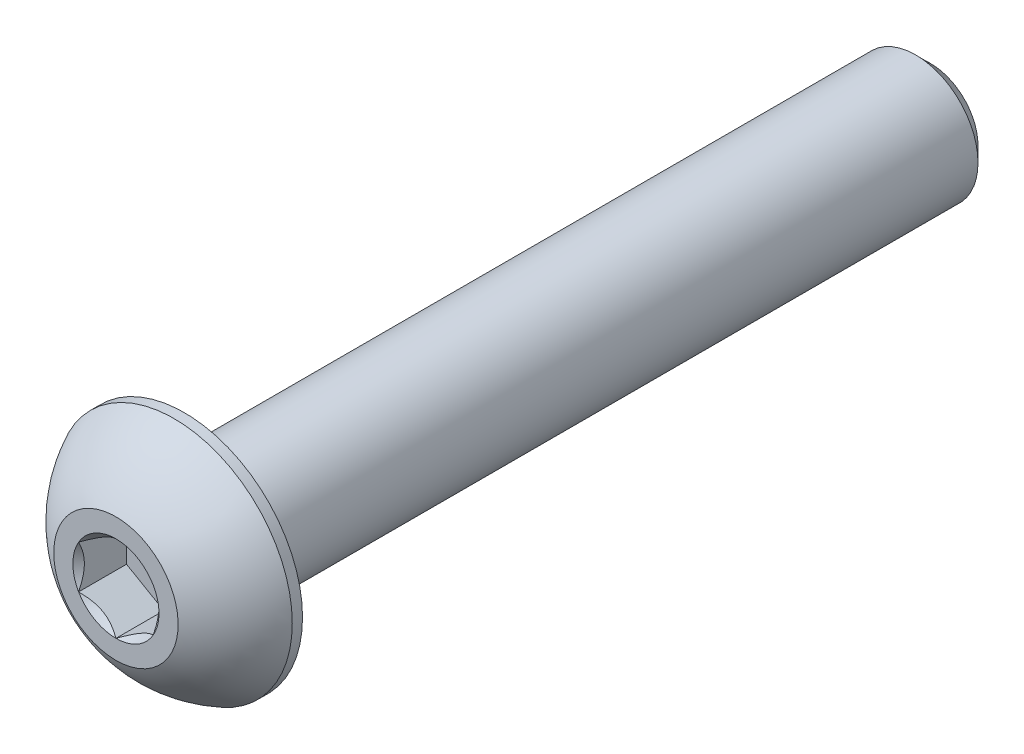
from build123d import *

# Parameters (mm, degrees)
CUT_EXTRUDE2_DEPTH = 1.925


with BuildPart() as part:
    # Sketch10 → Revolve3 (revolve)
    with BuildSketch(Plane(origin=(0, 0, 0), x_dir=(0, 0, -1), z_dir=(1, 0, 0)), mode=Mode.PRIVATE) as revolve3_sk:
        Polygon((32.15, 2.5), (32.75, 1.9), (32.75, 0), (2.75, 0), (2.75, 2.5), align=None)
    revolve(revolve3_sk.sketch.rotate(Axis((0, 0, 0), (0, 0, -1)), 90), axis=Axis((0, 0, 0), (0, 0, -1)))

    # Sketch7 → Revolve2 (revolve)
    with BuildSketch(Plane(origin=(0, 0, 0), x_dir=(0, 0, -1), z_dir=(1, 0, 0)), mode=Mode.PRIVATE) as revolve2_sk:
        with BuildLine():
            Line((2.3375, 4.75), (2.75, 4.75))
            Line((2.75, 4.75), (2.75, 0))
            Line((2.75, 0), (0, 0))
            Line((0, 0), (0, 2.5))
            ThreePointArc((0, 2.5), (0.991875183, 3.808753282), (2.3375, 4.75))
        make_face()
    revolve(revolve2_sk.sketch.rotate(Axis((0, 0, 0), (0, 0, -1)), 180), axis=Axis((0, 0, 0), (0, 0, -1)))

    # Sketch5 → Cut-Extrude2 (cut)
    with BuildSketch(Plane.XY):
        Polygon((1.5, -0.866025404), (1.5, 0.866025404), (0, 1.732050808), (-1.5, 0.866025404), (-1.5, -0.866025404), (0, -1.732050808), align=None)
    extrude(amount=-CUT_EXTRUDE2_DEPTH, mode=Mode.SUBTRACT)

    # Cut-Extrude3 cone 1 section (through the dimple's axis) → Cut-Extrude3 (revolve, cut)
    with BuildSketch(Plane(origin=(0, 0, 0), x_dir=(0, -1, 0), z_dir=(1, 0, 0))):
        Polygon((0, 0), (1.732050808, 0), (0, 1.732050808), align=None)
    revolve(axis=Axis((0, 0, 0), (0, 0, -1)), mode=Mode.SUBTRACT)


with BuildPart() as body_2:
    # Split1: read off the stored shape, not the designer's step
    # Split1: the piece on the far side of the plane
    add(part.part)
    split(bisect_by=Plane.XY.offset(-2.75), keep=Keep.BOTTOM)


with BuildPart() as part_1:
    add(part.part)

    # Split1
    split(bisect_by=Plane.XY.offset(-2.75), keep=Keep.TOP)


with BuildPart() as body_2_1:
    add(body_2.part)

    # Boss-Extrude1: read off the stored shape, not the designer's step
    # Boss-Extrude1: union part
    add(part_1.part)


solid = body_2_1.part
